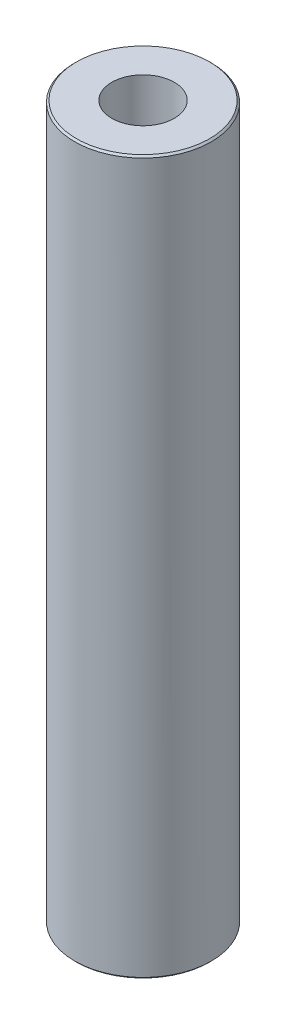
from build123d import *

# Parameters (mm, degrees)
SKETCH1_R           = 57.5
BOSS_EXTRUDE1_DEPTH = 600
SKETCH2_R           = 26.303818492
CUT_EXTRUDE1_DEPTH  = 606.485342515
CHAMFER1_SIZE       = 1.492700351


with BuildPart() as part:
    # Sketch1 → Boss-Extrude1 (new body)
    with BuildSketch(Plane(origin=(0, 0, 0), x_dir=(1, 0, 0), z_dir=(0, 1, 0))):
        Circle(SKETCH1_R)
    extrude(amount=BOSS_EXTRUDE1_DEPTH)

    # Sketch2 → Cut-Extrude1 (cut, through all)
    with BuildSketch(Plane(origin=(0, 0, 0), x_dir=(1, 0, 0), z_dir=(0, 1, 0))):
        Circle(SKETCH2_R)
    extrude(amount=CUT_EXTRUDE1_DEPTH, mode=Mode.SUBTRACT)

    # Chamfer1
    chamfer1_edges = [part.edges().sort_by_distance(p)[0] for p in [
        (-57.5, 600, 0),
        (-57.5, 0, 0),
    ]]
    chamfer(chamfer1_edges, length=CHAMFER1_SIZE)


solid = part.part
